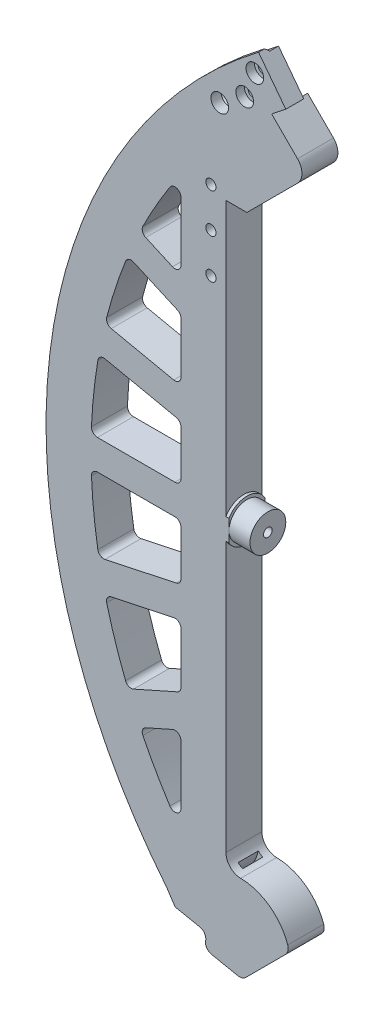
from build123d import *
from build123d.topology import SkipClean

# Parameters (mm, degrees)
AUFSATZ_LINEAR_AUSTRAGEN1_DEPTH       = 12
SKIZZE2_R                             = 5.975
AUFSATZ_LINEAR_AUSTRAGEN2_DEPTH       = 8
AUFSATZ_LINEAR_AUSTRAGEN3_DEPTH       = 1
SCHNITT_LINEAR_AUSTRAGEN1_DEPTH       = 255.841126979
VERRUNDUNG1_R                         = 2
VERRUNDUNG1_OF_SPIEGELN2_R            = 2
AUFSATZ_LINEAR_AUSTRAGEN4_DEPTH       = 12
SCHNITT_LINEAR_AUSTRAGEN2_DEPTH       = 255.841126979
VERRUNDUNG2_R                         = 5
VERRUNDUNG2_OF_SPIEGELN3_R            = 5
VERRUNDUNG3_R                         = 5
SCHNITT_LINEAR_AUSTRAGEN3_DEPTH       = 255.841126979
SKIZZE8_R                             = 217.169357413
SKIZZE8_R_2                           = 180
SCHNITT_LINEAR_AUSTRAGEN4_DEPTH       = 255.841126979
SKIZZE11_R                            = 1.7
SCHNITT_LINEAR_AUSTRAGEN6_DEPTH       = 255.841126979
AUFSATZ_LINEAR_AUSTRAGEN5_DEPTH       = 1
SKIZZE17_R                            = 1.7
SCHNITT_LINEAR_AUSTRAGEN9_DEPTH       = 255.841126979
SKIZZE17_7_R                          = 1.7
SCHNITT_LINEAR_AUSTRAGEN16_DEPTH      = 6
FASE1_SIZE                            = 1
SKIZZE21_R                            = 2.95
SCHNITT_LINEAR_AUSTRAGEN20_DEPTH      = 2.5
SCHNITT_LINEAR_AUSTRAGEN28_DEPTH      = 400.457969312
SKIZZE31_R                            = 2.9
SCHNITT_LINEAR_AUSTRAGEN29_DEPTH      = 6
SKIZZE33_R                            = 2.95
SCHNITT_LINEAR_AUSTRAGEN30_DEPTH      = 2.8
SKIZZE33_3_R                          = 2.95
SCHNITT_LINEAR_AUSTRAGEN44_DEPTH      = 4
FASE5_SIZE                            = 0.62
K_RPER_VERSCHIEBEN_KOPIEREN1_ANGLE    = 90
SCHNITT_ROTATION2_START               = -1.484065885
SCHNITT_ROTATION2_DEPTH               = 5.8
FASE2_SIZE                            = 1.1
SKIZZE37_R                            = 1.5
SCHNITT_LINEAR_AUSTRAGEN32_DEPTH      = 6
SCHNITT_LINEAR_AUSTRAGEN39_DEPTH      = 229.129577254
SCHNITT_LINEAR_AUSTRAGEN40_DEPTH      = 3.35
SKIZZE46_W                            = 20.526751733
SKIZZE46_H                            = 12
SCHNITT_LINEAR_AUSTRAGEN41_DEPTH      = 321.608809185
AUFSATZ_LINEAR_AUSTRAGEN10_REACH      = 322.609
SKIZZE47_W                            = 7.305884698
SKIZZE47_H                            = 12
SCHNITT_LINEAR_AUSTRAGEN42_REACH      = 322.609
SCHNITT_LINEAR_AUSTRAGEN42_END_RADIUS = 19.399208801
SKIZZE48_R                            = 1.45
VERRUNDUNG9_R                         = 3
VERRUNDUNG10_R                        = 2.5
FASE4_SIZE                            = 3.57
SKIZZE50_R                            = 1.45
SCHNITT_LINEAR_AUSTRAGEN43_DEPTH      = 8
SKIZZE51_R                            = 1.45
SCHNITT_LINEAR_AUSTRAGEN45_DEPTH      = 10


# Read off the part's stored shape, not the designer's step: Schnitt-Rotation2
with BuildPart() as part:
    # Skizze1 → Aufsatz-Linear austragen1 (new body)
    with BuildSketch(Plane(origin=(0, 0, 0), x_dir=(1, 0, 0), z_dir=(0, 1, 0))):
        with BuildLine():
            Line((-127.279220614, 127.279220614), (-120, 120))
            Line((-120, 120), (-120, -113.247516529))
            ThreePointArc((-120, -113.247516529), (0, -165), (120, -113.247516529))
            Line((120, -113.247516529), (120, 120))
            Line((120, 120), (127.279220614, 127.279220614))
            Line((127.279220614, 127.279220614), (122.965849596, 131.45113097))
            Line((122.965849596, 131.45113097), (124.380063158, 132.865344532))
            Line((124.380063158, 132.865344532), (132.865344532, 124.380063158))
            Line((132.865344532, 124.380063158), (131.45113097, 122.965849596))
            ThreePointArc((131.45113097, 122.965849596), (180, 0), (131.45113097, -122.965849596))
            Line((131.45113097, -122.965849596), (132.865344532, -124.380063158))
            Line((132.865344532, -124.380063158), (124.380063158, -132.865344532))
            Line((124.380063158, -132.865344532), (122.965849596, -131.45113097))
            ThreePointArc((122.965849596, -131.45113097), (66.101423681, -167.423420665), (0, -180))
            ThreePointArc((0, -180), (-66.101423681, -167.423420665), (-122.965849596, -131.45113097))
            Line((-122.965849596, -131.45113097), (-124.380063158, -132.865344532))
            Line((-124.380063158, -132.865344532), (-132.865344532, -124.380063158))
            Line((-132.865344532, -124.380063158), (-131.45113097, -122.965849596))
            ThreePointArc((-131.45113097, -122.965849596), (-180, 0), (-131.45113097, 122.965849596))
            Line((-131.45113097, 122.965849596), (-132.865344532, 124.380063158))
            Line((-132.865344532, 124.380063158), (-124.380063158, 132.865344532))
            Line((-124.380063158, 132.865344532), (-122.965849596, 131.45113097))
            Line((-122.965849596, 131.45113097), (-127.279220614, 127.279220614))
        make_face()
    extrude(amount=AUFSATZ_LINEAR_AUSTRAGEN1_DEPTH)

    # Skizze2 → Aufsatz-Linear austragen2 (add)
    with BuildSketch(Plane.ZY.offset(-120)):
        with Locations(Location((0, 6, 0), (0, 0, 180))):
            Circle(SKIZZE2_R)
    aufsatz_linear_austragen2 = extrude(amount=AUFSATZ_LINEAR_AUSTRAGEN2_DEPTH)

    # Skizze3 → Aufsatz-Linear austragen3 (add)
    with BuildSketch(Plane.ZY.offset(-120)):
        with BuildLine():
            Line((-3.55677171, 12), (3.55677171, 12))
            ThreePointArc((3.55677171, 12), (6.975, 6), (3.55677171, 0))
            Line((3.55677171, 0), (-3.55677171, 0))
            ThreePointArc((-3.55677171, 0), (-6.975, 6), (-3.55677171, 12))
        make_face()
    aufsatz_linear_austragen3 = extrude(amount=AUFSATZ_LINEAR_AUSTRAGEN3_DEPTH)

    # Spiegeln1: Aufsatz-Linear austragen2, Aufsatz-Linear austragen3 across plane
    add(aufsatz_linear_austragen2.mirror(Plane(origin=(0, 0, 0), x_dir=(0, 0, 1), z_dir=(1, 0, 0))))
    add(aufsatz_linear_austragen3.mirror(Plane(origin=(0, 0, 0), x_dir=(0, 0, 1), z_dir=(1, 0, 0))))

    # Skizze4 → Schnitt-Linear austragen1 (cut, through all)
    with BuildSketch(Plane(origin=(0, 12, 0), x_dir=(1, 0, 0), z_dir=(0, 1, 0))):
        with BuildLine():
            Line((135, 94.868329805), (135, 65.579053909))
            Line((135, 65.579053909), (148.632093411, 71.648452937))
            ThreePointArc((148.632093411, 71.648452937), (142.290483778, 83.536927322), (135, 94.868329805))
        make_face()
        with BuildLine():
            Line((135, 5), (164.924225025, 5))
            ThreePointArc((164.924225025, 5), (164.096112736, 17.247196439), (162.359793465, 29.398936478))
            Line((162.359793465, 29.398936478), (135, 23.583432851))
            Line((135, 23.583432851), (135, 5))
        make_face()
        with BuildLine():
            Line((135, 33.8068388), (160.280676557, 39.180412485))
            ThreePointArc((160.280676557, 39.180412485), (156.924325189, 50.987804072), (152.699459842, 62.51299836))
            Line((152.699459842, 62.51299836), (135, 54.632691124))
            Line((135, 54.632691124), (135, 33.8068388))
        make_face()
        with BuildLine():
            Line((135, -5), (164.924225025, -5))
            ThreePointArc((164.924225025, -5), (164.096112736, -17.247196439), (162.359793465, -29.398936478))
            Line((162.359793465, -29.398936478), (135, -23.583432851))
            Line((135, -23.583432851), (135, -5))
        make_face()
        with BuildLine():
            Line((135, -33.8068388), (160.280676557, -39.180412485))
            ThreePointArc((160.280676557, -39.180412485), (156.924325189, -50.987804072), (152.699459842, -62.51299836))
            Line((152.699459842, -62.51299836), (135, -54.632691124))
            Line((135, -54.632691124), (135, -33.8068388))
        make_face()
        with BuildLine():
            Line((135, -65.579053909), (148.632093411, -71.648452937))
            ThreePointArc((148.632093411, -71.648452937), (142.290483778, -83.536927322), (135, -94.868329805))
            Line((135, -94.868329805), (135, -65.579053909))
        make_face()
    schnitt_linear_austragen1 = extrude(amount=-SCHNITT_LINEAR_AUSTRAGEN1_DEPTH, mode=Mode.SUBTRACT)

    # Verrundung1
    verrundung1_edges = [part.edges().sort_by_distance(p)[0] for p in [
        (148.632093411, 6, 71.648452937),
        (135, 6, 94.868329805),
        (135, 6, 65.579053909),
        (135, 6, 54.632691124),
        (135, 6, 33.8068388),
        (160.280676557, 6, 39.180412485),
        (152.699459842, 6, 62.51299836),
        (135, 6, 23.583432851),
        (135, 6, 5),
        (164.924225025, 6, 5),
        (162.359793465, 6, 29.398936478),
        (135, 6, -33.8068388),
        (135, 6, -54.632691124),
        (152.699459842, 6, -62.51299836),
        (160.280676557, 6, -39.180412485),
        (135, 6, -94.868329805),
        (148.632093411, 6, -71.648452937),
        (135, 6, -65.579053909),
        (135, 6, -5),
        (135, 6, -23.583432851),
        (162.359793465, 6, -29.398936478),
        (164.924225025, 6, -5),
    ]]
    fillet(verrundung1_edges, radius=VERRUNDUNG1_R)

    # Spiegeln2: Schnitt-Linear austragen1 across plane
    add(schnitt_linear_austragen1.mirror(Plane(origin=(0, 0, 0), x_dir=(0, 0, 1), z_dir=(1, 0, 0))), mode=Mode.SUBTRACT)

    # Verrundung1 of Spiegeln2
    verrundung1_of_spiegeln2_edges = [part.edges().sort_by_distance(p)[0] for p in [
        (-148.632093411, 6, 71.648452937),
        (-135, 6, 94.868329805),
        (-135, 6, 65.579053909),
        (-135, 6, 54.632691124),
        (-135, 6, 33.8068388),
        (-160.280676557, 6, 39.180412485),
        (-152.699459842, 6, 62.51299836),
        (-135, 6, 23.583432851),
        (-135, 6, 5),
        (-164.924225025, 6, 5),
        (-162.359793465, 6, 29.398936478),
        (-135, 6, -33.8068388),
        (-135, 6, -54.632691124),
        (-152.699459842, 6, -62.51299836),
        (-160.280676557, 6, -39.180412485),
        (-135, 6, -94.868329805),
        (-148.632093411, 6, -71.648452937),
        (-135, 6, -65.579053909),
        (-135, 6, -5),
        (-135, 6, -23.583432851),
        (-162.359793465, 6, -29.398936478),
        (-164.924225025, 6, -5),
    ]]
    fillet(verrundung1_of_spiegeln2_edges, radius=VERRUNDUNG1_OF_SPIEGELN2_R)

    # Skizze6 → Aufsatz-Linear austragen4 (add)
    # profile 1 of 2: a face of its own
    with BuildSketch(Plane.XZ):
        Polygon((-115.343258147, 106.716555417), (-120, 111.37329727), (-120, 87.91767794), (-92.574419793, 115.343258147), (-104.731449678, 127.500288032), (-107.477197557, 126.300642478), (-112.279508622, 120.906211352), (-106.716555417, 115.343258147), align=None)
    # profile 2 of 2: a face of its own
    with BuildSketch(Plane.XZ):
        with BuildLine():
            Line((-127.279220614, -127.279220614), (-126.134036513, -104.18240391))
            Line((-126.134036513, -104.18240391), (-120, -99.118303438))
            ThreePointArc((-120, -99.118303438), (-99.000407319, -119.567666603), (-127.279220614, -127.279220614))
        make_face()
        Polygon((-123.969960878, -115.343258147), (-115.343258147, -106.716555417), (-106.716555417, -115.343258147), (-115.343258147, -123.969960878), align=None, mode=Mode.SUBTRACT)
    aufsatz_linear_austragen4 = extrude(amount=-AUFSATZ_LINEAR_AUSTRAGEN4_DEPTH)

    # Skizze6<3> → Schnitt-Linear austragen2 (cut, through all)
    with BuildSketch(Plane.XZ):
        Polygon((-115.343258147, 106.716555417), (-106.716555417, 115.343258147), (-115.343258147, 123.969960878), (-123.969960878, 115.343258147), align=None)
        Polygon((-115.343258147, -106.716555417), (-106.716555417, -115.343258147), (-115.343258147, -123.969960878), (-123.969960878, -115.343258147), align=None)
    schnitt_linear_austragen2 = extrude(amount=-SCHNITT_LINEAR_AUSTRAGEN2_DEPTH, mode=Mode.SUBTRACT)

    # Verrundung2
    verrundung2_edges = [part.edges().sort_by_distance(p)[0] for p in [
        (-92.574419793, 6, 115.343258147),
    ]]
    fillet(verrundung2_edges, radius=VERRUNDUNG2_R)

    # Spiegeln3: Aufsatz-Linear austragen4, Schnitt-Linear austragen2 across plane
    add(aufsatz_linear_austragen4.mirror(Plane(origin=(0, 0, 0), x_dir=(0, 0, 1), z_dir=(1, 0, 0))))
    add(schnitt_linear_austragen2.mirror(Plane(origin=(0, 0, 0), x_dir=(0, 0, 1), z_dir=(1, 0, 0))), mode=Mode.SUBTRACT)

    # Verrundung2 of Spiegeln3
    verrundung2_of_spiegeln3_edges = [part.edges().sort_by_distance(p)[0] for p in [
        (92.574419793, 6, 115.343258147),
    ]]
    fillet(verrundung2_of_spiegeln3_edges, radius=VERRUNDUNG2_OF_SPIEGELN3_R)

    # Verrundung3
    verrundung3_edges = [part.edges().sort_by_distance(p)[0] for p in [
        (-120, 6, -99.118303438),
    ]]
    fillet(verrundung3_edges, radius=VERRUNDUNG3_R)

    # Skizze7 → Schnitt-Linear austragen3 (cut, through all)
    with BuildSketch(Plane.XZ):
        Polygon((-120, 87.91767794), (-120, 94.91767794), (-113, 94.91767794), align=None)
    extrude(amount=-SCHNITT_LINEAR_AUSTRAGEN3_DEPTH, mode=Mode.SUBTRACT)

    # Skizze8 → Schnitt-Linear austragen4 (cut, through all)
    with SkipClean():  # the faces are left unmerged after this step: merging them gives an invalid solid
        with BuildSketch(Plane(origin=(0, 0, 0), x_dir=(1, 0, 0), z_dir=(0, 1, 0))):
            Circle(SKIZZE8_R)
            Circle(SKIZZE8_R_2, mode=Mode.SUBTRACT)
        extrude(amount=SCHNITT_LINEAR_AUSTRAGEN4_DEPTH, mode=Mode.SUBTRACT)

    # Skizze11 → Schnitt-Linear austragen6 (cut, through all)
    with SkipClean():  # the faces are left unmerged after this step: merging them gives an invalid solid
        with BuildSketch(Plane(origin=(0, 12, 0), x_dir=(1, 0, 0), z_dir=(0, 1, 0))):
            with Locations(Location((-125, -97, 0), (0, 0, 270))):
                Circle(SKIZZE11_R)
            with Locations(Location((-125, -83.82, 0), (0, 0, 270))):
                Circle(SKIZZE11_R)
            with Locations(Location((-125, -70.64, 0), (0, 0, 270))):
                Circle(SKIZZE11_R)
        extrude(amount=-SCHNITT_LINEAR_AUSTRAGEN6_DEPTH, mode=Mode.SUBTRACT)

    # Skizze12 → Aufsatz-Linear austragen5 (add)
    with SkipClean():  # the faces are left unmerged after this step: merging them gives an invalid solid
        with BuildSketch(Plane.XZ):
            Polygon((-115.343258147, 123.969960878), (-106.716555417, 115.343258147), (-115.343258147, 106.716555417), (-123.969960878, 115.343258147), align=None)
            Polygon((123.969960878, 115.343258147), (115.343258147, 123.969960878), (106.716555417, 115.343258147), (115.343258147, 106.716555417), align=None)
            Polygon((115.343258147, -123.969960878), (106.716555417, -115.343258147), (115.343258147, -106.716555417), (123.969960878, -115.343258147), align=None)
            Polygon((-123.969960878, -115.343258147), (-115.343258147, -123.969960878), (-106.716555417, -115.343258147), (-115.343258147, -106.716555417), align=None)
        extrude(amount=-AUFSATZ_LINEAR_AUSTRAGEN5_DEPTH)

    # Skizze17 → Schnitt-Linear austragen9 (cut, through all)
    with SkipClean():  # the faces are left unmerged after this step: merging them gives an invalid solid
        with BuildSketch(Plane(origin=(0, 12, 0), x_dir=(1, 0, 0), z_dir=(0, 1, 0))):
            with Locations(Location((-122.060772568, -122.060772568, 0), (0, 0, 270))):
                Circle(SKIZZE17_R)
            with Locations(Location((-113.71691255, -128.00046953, 0), (0, 0, 270))):
                Circle(SKIZZE17_R)
            with Locations(Location((-110.347991921, -136.514729866, 0), (0, 0, 270))):
                Circle(SKIZZE17_R)
        schnitt_linear_austragen9 = extrude(amount=-SCHNITT_LINEAR_AUSTRAGEN9_DEPTH, mode=Mode.SUBTRACT)

    # Skizze17<7> → Schnitt-Linear austragen16 (cut)
    with SkipClean():  # the faces are left unmerged after this step: merging them gives an invalid solid
        with BuildSketch(Plane(origin=(0, 12, 0), x_dir=(1, 0, 0), z_dir=(0, 1, 0))):
            Polygon((-129.954981725, -137.434890651), (-111.481289104, -146.249211371), (-99.867474616, -131.01337024), (-104.731449678, -127.500288032), (-111.80251749, -120.42922022), (-115.343258147, -123.969960878), (-123.969960878, -115.343258147), (-131.51946364, -122.892760909), align=None)
            with Locations(Location((-113.71691255, -128.00046953, 0), (0, 0, 270))):
                Circle(SKIZZE17_7_R, mode=Mode.SUBTRACT)
            with Locations(Location((-110.347991921, -136.514729866, 0), (0, 0, 270))):
                Circle(SKIZZE17_7_R, mode=Mode.SUBTRACT)
            with Locations(Location((-122.060772568, -122.060772568, 0), (0, 0, 270))):
                Circle(SKIZZE17_7_R, mode=Mode.SUBTRACT)
        extrude(amount=-SCHNITT_LINEAR_AUSTRAGEN16_DEPTH, mode=Mode.SUBTRACT)

    # Spiegeln8: Schnitt-Linear austragen9 across plane
    with SkipClean():  # the faces are left unmerged after this step: merging them gives an invalid solid
        add(schnitt_linear_austragen9.mirror(Plane(origin=(0, 0, 0), x_dir=(0, 0, 1), z_dir=(1, 0, 0))), mode=Mode.SUBTRACT)

    # Fase1
    fase1_edges = [part.edges().sort_by_distance(p)[0] for p in [
        (-179.999993048, 12, -0.050028267),
    ]]
    chamfer(fase1_edges, length=FASE1_SIZE)

    # Skizze21 → Schnitt-Linear austragen20 (cut)
    with SkipClean():  # the faces are left unmerged after this step: merging them gives an invalid solid
        with BuildSketch(Plane(origin=(0, 12, 0), x_dir=(1, 0, 0), z_dir=(0, 1, 0))):
            with Locations((-122.060772568, -122.060772568)):
                Circle(SKIZZE21_R)
            with Locations((-113.71691255, -128.00046953)):
                Circle(SKIZZE21_R)
            with Locations((-110.347991921, -136.514729866)):
                Circle(SKIZZE21_R)
            with Locations(Location((110.347991921, -136.514729866, 0), (0, 0, 90))):
                Circle(SKIZZE21_R)
            with Locations(Location((113.71691255, -128.00046953, 0), (0, 0, 90))):
                Circle(SKIZZE21_R)
            with Locations(Location((122.060772568, -122.060772568, 0), (0, 0, 90))):
                Circle(SKIZZE21_R)
        extrude(amount=-SCHNITT_LINEAR_AUSTRAGEN20_DEPTH, mode=Mode.SUBTRACT)

    # Skizze29 → Schnitt-Linear austragen28 (cut, through all)
    with SkipClean():  # the faces are left unmerged after this step: merging them gives an invalid solid
        with BuildSketch(Plane(origin=(-109.120796797, 0, 143.152546978), x_dir=(0.7952919276581147, 0, 0.6062266488713937), z_dir=(-0.6062266488713937, 0, 0.7952919276581147))):
            Polygon((0, 12), (0, -9.771833037), (123.295870212, -52.769688315), (243.137893101, -38.974923091), (225.678893364, 65.779075334), (63.805945181, 70.521025879), (0, 48.10453239), align=None)
        extrude(amount=-SCHNITT_LINEAR_AUSTRAGEN28_DEPTH, mode=Mode.SUBTRACT)

    # Skizze31 → Schnitt-Linear austragen29 (cut)
    with SkipClean():  # the faces are left unmerged after this step: merging them gives an invalid solid
        with BuildSketch(Plane(origin=(0, 12, 0), x_dir=(1, 0, 0), z_dir=(0, 1, 0))):
            with Locations(Location((-125, -70.64, 0), (0, 0, 270))):
                Circle(SKIZZE31_R)
            with Locations(Location((-125, -83.82, 0), (0, 0, 270))):
                Circle(SKIZZE31_R)
            with Locations(Location((-125, -97, 0), (0, 0, 270))):
                Circle(SKIZZE31_R)
        extrude(amount=-SCHNITT_LINEAR_AUSTRAGEN29_DEPTH, mode=Mode.SUBTRACT)

    # Skizze33 → Schnitt-Linear austragen30 (cut)
    with SkipClean():  # the faces are left unmerged after this step: merging them gives an invalid solid
        with BuildSketch(Plane.XZ):
            with Locations(Location((-113.71691255, 128.00046953, 0), (0, 0, 270))):
                Circle(SKIZZE33_R)
            with Locations(Location((-110.347991921, 136.514729866, 0), (0, 0, 270))):
                Circle(SKIZZE33_R)
        extrude(amount=-SCHNITT_LINEAR_AUSTRAGEN30_DEPTH, mode=Mode.SUBTRACT)

    # Skizze33<3> → Schnitt-Linear austragen44 (cut)
    with SkipClean():  # the faces are left unmerged after this step: merging them gives an invalid solid
        with BuildSketch(Plane.XZ):
            with Locations(Location((-122.060772568, 122.060772568, 0), (0, 0, 270))):
                Circle(SKIZZE33_3_R)
        extrude(amount=-SCHNITT_LINEAR_AUSTRAGEN44_DEPTH, mode=Mode.SUBTRACT)

    # Fase5
    fase5_edges = [part.edges().sort_by_distance(p)[0] for p in [
        (-122.060772568, 4, 125.010772568),
        (-122.060772568, 4, 120.360772568),
    ]]
    chamfer(fase5_edges, length=FASE5_SIZE)


with BuildPart() as part_1:
    # Körper-Verschieben/Kopieren1: moved
    add(part.part.rotate(Axis((0, 1.951289699, 5.464644416), (-1, 0, 0)), K_RPER_VERSCHIEBEN_KOPIEREN1_ANGLE))

    # Schnitt-Rotation2 outline → Schnitt-Rotation2 (cut)
    with BuildSketch(Plane.XY.offset(SCHNITT_ROTATION2_START)):
        with BuildLine():
            ThreePointArc((-126.874722265, -131.183807813), (-124.569198659, -132.992256524), (-121.985669867, -134.374756005))
            ThreePointArc((-121.985669867, -134.374756005), (-178.68086077, 5.338763354), (-108.453947483, 138.764371141))
            Line((-108.453947483, 138.764371141), (-109.120796797, 139.639192262))
            ThreePointArc((-109.120796797, 139.639192262), (-179.771654729, 5.550427932), (-122.965849596, -134.964485686))
            Line((-122.965849596, -134.964485686), (-126.874722265, -131.183807813))
        make_face()
    extrude(amount=SCHNITT_ROTATION2_DEPTH, mode=Mode.SUBTRACT)

    # Fase2
    fase2_edges = [part_1.edges().sort_by_distance(p)[0] for p in [
        (-179.999993047, -3.563382983, -1.484065885),
        (-180, -3.513354717, 4.315934115),
    ]]
    chamfer(fase2_edges, length=FASE2_SIZE - 0.0001)  # a hair under: the kernel refuses the full size

    # Skizze37 → Schnitt-Linear austragen32 (cut)
    with BuildSketch(Plane(origin=(0, 0, -4.584065885), x_dir=(-1, 0, 0), z_dir=(0, 0, -1))):
        with Locations(Location((136.746021663, -3.513354717, 0), (0, 0, 90))):
            Circle(SKIZZE37_R)
        with Locations(Location((163.246021663, -3.513354717, 0), (0, 0, 90))):
            Circle(SKIZZE37_R)
    extrude(amount=-SCHNITT_LINEAR_AUSTRAGEN32_DEPTH, mode=Mode.SUBTRACT)

    # Skizze43 → Schnitt-Linear austragen39 (cut, through all)
    with BuildSketch(Plane(origin=(0, 0, -4.584065885), x_dir=(-1, 0, 0), z_dir=(0, 0, -1))):
        Polygon((98.853828028, -115.246475148), (114.495270283, -130.887917403), (132.055248239, -127.36804616), (132.785654922, -136.258035369), (118.151999592, -141.358205804), (102.106903175, -142.659519406), (88.19196428, -122.667333722), align=None)
    extrude(amount=-SCHNITT_LINEAR_AUSTRAGEN39_DEPTH, mode=Mode.SUBTRACT)

    # Skizze44 → Schnitt-Linear austragen40 (cut, symmetric)
    with BuildSketch(Plane(origin=(0, 0, 1.415934115), x_dir=(-1, 0, 0), z_dir=(0, 0, -1))):
        with BuildLine():
            Line((117.070712351, -101.530365939), (116.714553979, -100.195535724))
            Line((116.714553979, -100.195535724), (117.435823246, -99.775269442))
            Line((117.435823246, -99.775269442), (118.563159088, -99.474474559))
            Line((118.563159088, -99.474474559), (118.563159088, -100.486996749))
            ThreePointArc((118.563159088, -100.486996749), (127.039401443, -111.900159268), (141.176868695, -113.396482382))
            Line((141.176868695, -113.396482382), (142.868509226, -113.005770306))
            Line((142.868509226, -113.005770306), (142.868509226, -113.396482382))
            Line((142.868509226, -113.396482382), (142.868509226, -115.555966234))
            Line((142.868509226, -115.555966234), (139.597468474, -115.555966234))
            ThreePointArc((139.597468474, -115.555966234), (125.560837576, -112.997334821), (117.070712351, -101.530365939))
        make_face()
    extrude(amount=SCHNITT_LINEAR_AUSTRAGEN40_DEPTH, both=True, mode=Mode.SUBTRACT)

    # Skizze46 → Schnitt-Linear austragen41 (cut, through all)
    with SkipClean():  # the faces are left unmerged after this step: merging them gives an invalid solid
        with BuildSketch(Plane(origin=(-28.643298237, -142.89604669, 0), x_dir=(0.9804960167130297, -0.19653895596009066, -6.524242016866202e-14), z_dir=(0.19653895596009066, 0.9804960167130297, 3.2548220673910937e-13))):
            with Locations((-109.820957749, -1.415934115)):
                Rectangle(SKIZZE46_W, SKIZZE46_H)
        extrude(amount=-SCHNITT_LINEAR_AUSTRAGEN41_DEPTH, mode=Mode.SUBTRACT)

    # Skizze47 → Aufsatz-Linear austragen10 (add, up to next)
    with BuildSketch(Plane(origin=(-28.643298237, -142.89604669, 0), x_dir=(0.9804960167130297, -0.19653895596009066, -6.524242016866202e-14), z_dir=(0.19653895596009066, 0.9804960167130297, 3.2548220673910937e-13)), mode=Mode.PRIVATE) as aufsatz_linear_austragen10_sk1:
        with Locations((-110.355685082, -1.415934115)):
            Rectangle(SKIZZE47_W, SKIZZE47_H)
    aufsatz_linear_austragen10_tool1 = extrude(aufsatz_linear_austragen10_sk1.sketch, amount=AUFSATZ_LINEAR_AUSTRAGEN10_REACH, mode=Mode.PRIVATE) - part_1.part
    add(aufsatz_linear_austragen10_tool1.solids().sort_by_distance((-136.846608, -121.206856, 1.415934))[0])

    # Schnitt-Linear austragen42: up to this cylinder (the profile starts outside it)
    with SkipClean():  # the faces are left unmerged after this step: merging them gives an invalid solid
        schnitt_linear_austragen42_end = Plane(origin=(-135.814193572, -96.529244679, 1.415934), z_dir=(0, 0, -1)) * Cylinder(SCHNITT_LINEAR_AUSTRAGEN42_END_RADIUS, 685.016417602, mode=Mode.PRIVATE)
        # Skizze48 → Schnitt-Linear austragen42 (cut, up to the surface)
        with BuildSketch(Plane(origin=(-28.643298237, -142.89604669, 0), x_dir=(0.9804960167130297, -0.19653895596009044, -6.546062224280144e-14), z_dir=(-0.19653895596009047, -0.9804960167130298, -3.265707759924017e-13)), mode=Mode.PRIVATE) as schnitt_linear_austragen42_sk1:
            with Locations((-105.083260477, 1.415934115)):
                Circle(SKIZZE48_R)
        schnitt_linear_austragen42_tool1 = extrude(schnitt_linear_austragen42_sk1.sketch, amount=-SCHNITT_LINEAR_AUSTRAGEN42_REACH, mode=Mode.PRIVATE) - schnitt_linear_austragen42_end
        add(schnitt_linear_austragen42_tool1.solids().sort_by_distance((-131.677017, -122.243092, 1.415934))[0], mode=Mode.SUBTRACT)

    # Verrundung9
    verrundung9_edges = [part_1.edges().sort_by_distance(p)[0] for p in [
        (-114.495270283, -130.887917403, 1.415934115),
        (-98.853828028, -115.246475148, 1.415934115),
    ]]
    fillet(verrundung9_edges, radius=VERRUNDUNG9_R)

    # Verrundung10
    verrundung10_edges = [part_1.edges().sort_by_distance(p)[0] for p in [
        (-127.261328491, -128.328980183, 1.415934115),
        (-126.259110706, -123.329103489, 1.415934115),
    ]]
    fillet(verrundung10_edges, radius=VERRUNDUNG10_R)

    # Fase4
    fase4_edges = [part_1.edges().sort_by_distance(p)[0] for p in [
        (-140.428303304, -120.488910085, 1.415934115),
    ]]
    chamfer(fase4_edges, length=FASE4_SIZE)

    # Skizze50 → Schnitt-Linear austragen43 (cut)
    with SkipClean():  # the faces are left unmerged after this step: merging them gives an invalid solid
        with BuildSketch(Plane(origin=(0, 0, -4.584065885), x_dir=(-1, 0, 0), z_dir=(0, 0, -1))):
            with Locations(Location((108.625743726, 105.112389009, 0), (0, 0, 90))):
                Circle(SKIZZE50_R)
            with Locations(Location((108.625743726, -112.139098443, 0), (0, 0, 90))):
                Circle(SKIZZE50_R)
            with Locations(Location((122.060772568, -125.574127285, 0), (0, 0, 270))):
                Circle(SKIZZE50_R)
        extrude(amount=-SCHNITT_LINEAR_AUSTRAGEN43_DEPTH, mode=Mode.SUBTRACT)

    # Skizze51 → Schnitt-Linear austragen45 (cut)
    with SkipClean():  # the faces are left unmerged after this step: merging them gives an invalid solid
        with BuildSketch(Plane(origin=(-112, 0, 0), x_dir=(0, 0, -1), z_dir=(1, 0, 0))):
            with Locations((-1.415934115, -3.513354717)):
                Circle(SKIZZE51_R)
        extrude(amount=-SCHNITT_LINEAR_AUSTRAGEN45_DEPTH, mode=Mode.SUBTRACT)


solid = part_1.part
